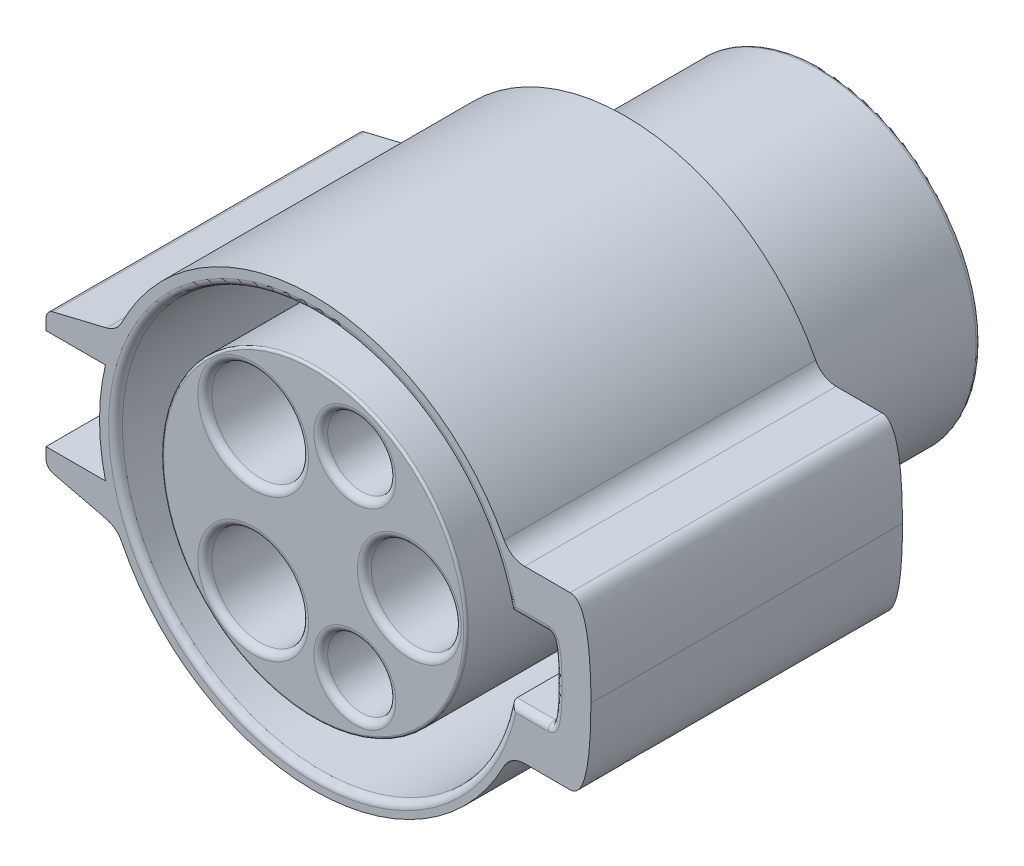
from build123d import *

# Parameters (mm, degrees)
BOSS_EXTRUDE2_DEPTH   = 31.75
SKETCH1_R             = 16.764
BOSS_EXTRUDE2_2_DEPTH = 31.75
BOSS_EXTRUDE3_START   = -2.54
SKETCH3_R             = 16.506246381
BOSS_EXTRUDE3_DEPTH   = 2.54
SKETCH4_R             = 17.526
BOSS_EXTRUDE4_DEPTH   = 24.13
SOCKETS_R             = 4.953
SOCKETS_R_2           = 3.7465
SOCKETS_R_3           = 5.334
CUT_EXTRUDE7_DEPTH    = 25.4
BOSS_EXTRUDE8_DEPTH   = 28.0924
CUT_EXTRUDE9_DEPTH    = 12.1158
CHAMFER4_SIZE         = 4.572
SCREWHOLES_R          = 1.27
CUT_EXTRUDE14_DEPTH   = 8.89
SKETCH11_R            = 5.6642
CUT_EXTRUDE15_DEPTH   = 22.86
SKETCH9_R             = 4.6482
CUT_EXTRUDE16_DEPTH   = 26.289
SKETCH10_R            = 5.6261
CUT_EXTRUDE17_DEPTH   = 26.7462
PIN_HOLES_R           = 0.762
PIN_HOLES_R_2         = 1.397
PIN_HOLES_R_3         = 1.8415
CUT_EXTRUDE18_DEPTH   = 57.15
FILLET2_R             = 2.54
FILLET1_R             = 0.762
FILLET3_R             = 0.762
FILLET4_R             = 0.762
FILLET5_R             = 2.54
FILLET7_R             = 0.254
FILLET8_R             = 0.508
FILLET9_R             = 0.508


with BuildPart() as part:
    # Sketch1 → Boss-Extrude2 (new body)
    with BuildSketch(Plane(origin=(0, 0, 0), x_dir=(-1, 0, 0), z_dir=(0, 0, 1))):
        with BuildLine():
            ThreePointArc((-21.65265327, -9.398341482), (-0.046598689, -23.566681465), (21.563577692, -9.40462903))
            Line((21.563577692, -9.40462903), (28.655385579, -7.694858892))
            ThreePointArc((28.655385579, -7.694858892), (29.198472422, -7.331979864), (29.408425429, -6.713478253))
            Line((29.408425429, -6.713478253), (29.408425429, -5.527673115))
            Line((29.408425429, -5.527673115), (22.863571754, -5.527673115))
            ThreePointArc((22.863571754, -5.527673115), (23.520338174, -0.003173115), (22.863571754, 5.521326885))
            Line((22.863571754, 5.521326885), (29.408425429, 5.521326885))
            Line((29.408425429, 5.521326885), (29.408425429, 6.701973171))
            ThreePointArc((29.408425429, 6.701973171), (29.198472422, 7.320474783), (28.655385579, 7.683353811))
            Line((28.655385579, 7.683353811), (21.563577692, 9.398282799))
            ThreePointArc((21.563577692, 9.398282799), (-0.043170424, 23.560335483), (-21.649918541, 9.398282799))
            Line((-21.649918541, 9.398282799), (-28.267762348, 9.398282799))
            add(Edge.make_bspline(
                [(-28.267762348, 9.398282799), (-28.485108011, 9.400451932), (-28.824047181, 9.276640589), (-29.19708151, 8.939349261), (-29.486145247, 8.48569004), (-29.78839701, 7.797643425), (-30.0551013, 6.826473269), (-30.270273152, 5.556194396), (-30.412261224, 4.212730774), (-30.527532893, 2.381439973), (-30.553793864, 0.956288487), (-30.55376699, 0)],
                knots=[0.008178357, 0.008178357, 0.008178357, 0.008178357, 0.0625, 0.125, 0.1875, 0.25, 0.375, 0.5, 0.625, 0.75, 0.99140647, 0.99140647, 0.99140647, 0.99140647], degree=3))
            add(Edge.make_bspline(
                [(-30.55376699, 0), (-30.553792628, -0.957105425), (-30.527486983, -2.383416883), (-30.411994616, -4.216077933), (-30.269722605, -5.560416862), (-30.054071551, -6.831375578), (-29.786697299, -7.802841402), (-29.483504172, -8.490718912), (-29.193429085, -8.943945804), (-28.820236065, -9.278541712), (-28.482332199, -9.400658469), (-28.267761491, -9.398341482)],
                knots=[0.008575453, 0.008575453, 0.008575453, 0.008575453, 0.25, 0.375, 0.5, 0.625, 0.75, 0.8125, 0.875, 0.9375, 0.991042124, 0.991042124, 0.991042124, 0.991042124], degree=3))
            Line((-28.267761491, -9.398341482), (-21.65265327, -9.398341482))
        make_face()
        with BuildLine():
            Line((-21.65265327, -4.280709616), (-25.856941927, -4.280709616))
            add(Edge.make_bspline(
                [(-26.618949643, 0), (-26.618952599, -0.409677807), (-26.61113914, -1.027795514), (-26.576415211, -1.835257877), (-26.532721349, -2.440331699), (-26.465680067, -3.022056645), (-26.380961079, -3.477974381), (-26.28265501, -3.812175786), (-26.18471138, -4.03861125), (-26.073308863, -4.197522787), (-25.951867174, -4.266036278), (-25.884930392, -4.280929674), (-25.856941927, -4.280709616)],
                knots=[0.013201178, 0.013201178, 0.013201178, 0.013201178, 0.25, 0.375, 0.5, 0.625, 0.75, 0.8125, 0.875, 0.9375, 0.96875, 0.984801607, 0.984801607, 0.984801607, 0.984801607], degree=3))
            add(Edge.make_bspline(
                [(-25.856941744, 4.280360411), (-25.891080394, 4.280844837), (-25.961281292, 4.263521273), (-26.081233259, 4.188207537), (-26.19056821, 4.028188874), (-26.286574032, 3.800969156), (-26.383475729, 3.466902404), (-26.467156775, 3.01187161), (-26.533512177, 2.431771639), (-26.576796215, 1.828599516), (-26.611211172, 1.023944975), (-26.618958231, 0.408107503), (-26.618949643, 0)],
                knots=[0.011727032, 0.011727032, 0.011727032, 0.011727032, 0.03125, 0.0625, 0.125, 0.1875, 0.25, 0.375, 0.5, 0.625, 0.75, 0.986731819, 0.986731819, 0.986731819, 0.986731819], degree=3))
            Line((-25.856941744, 4.280360411), (-21.680489311, 4.280360411))
            ThreePointArc((-21.680489311, 4.280360411), (21.759084844, 0.141022511), (-21.65265327, -4.280709616))
        make_face(mode=Mode.SUBTRACT)
    extrude(amount=BOSS_EXTRUDE2_DEPTH)



with BuildPart() as body_2:
    # Sketch1 → Boss-Extrude2 2 (new body)
    with BuildSketch(Plane(origin=(0, 0, 0), x_dir=(-1, 0, 0), z_dir=(0, 0, 1))):
        with Locations(Location((-0.043170424, -0.003173115, 0), (0, 0, 180))):
            Circle(SKETCH1_R)
    extrude(amount=BOSS_EXTRUDE2_2_DEPTH)


with BuildPart() as part_1:
    add(part.part)

    add(body_2.part)  # Boss-Extrude3 merges body 2
    # Sketch3 → Boss-Extrude3 (add)
    with BuildSketch(Plane.XY.offset(BOSS_EXTRUDE3_START)):
        with BuildLine():
            Line((-29.408425429, 5.527673115), (-22.863571754, 5.527673115))
            ThreePointArc((-22.863571754, 5.527673115), (-23.520338174, 0.003173115), (-22.863571754, -5.521326885))
            Line((-22.863571754, -5.521326885), (-29.408425429, -5.521326885))
            Line((-29.408425429, -5.521326885), (-29.408425429, -6.701973171))
            ThreePointArc((-29.408425429, -6.701973171), (-29.198472422, -7.320474783), (-28.655385579, -7.683353811))
            Line((-28.655385579, -7.683353811), (-21.563577692, -9.398282799))
            ThreePointArc((-21.563577692, -9.398282799), (0.043170424, -23.560335483), (21.649918541, -9.398282799))
            Line((21.649918541, -9.398282799), (28.267762348, -9.398282799))
            add(Edge.make_bspline(
                [(28.267762348, -9.398282799), (28.485108011, -9.400451932), (28.824047181, -9.276640589), (29.19708151, -8.939349261), (29.486145247, -8.48569004), (29.78839701, -7.797643425), (30.0551013, -6.826473269), (30.270273152, -5.556194396), (30.412261224, -4.212730774), (30.527532893, -2.381439973), (30.553793864, -0.956288487), (30.55376699, 0)],
                knots=[0.008178357, 0.008178357, 0.008178357, 0.008178357, 0.0625, 0.125, 0.1875, 0.25, 0.375, 0.5, 0.625, 0.75, 0.99140647, 0.99140647, 0.99140647, 0.99140647], degree=3, weights=[1, 1, 1, 1, 1, 1, 1, 1, 1, 1, 1, 1]))
            add(Edge.make_bspline(
                [(30.55376699, 0), (30.553792628, 0.957105425), (30.527486983, 2.383416883), (30.411994616, 4.216077933), (30.269722605, 5.560416862), (30.054071551, 6.831375578), (29.786697299, 7.802841402), (29.483504172, 8.490718912), (29.193429085, 8.943945804), (28.820236065, 9.278541712), (28.482332199, 9.400658469), (28.267761491, 9.398341482)],
                knots=[0.008575453, 0.008575453, 0.008575453, 0.008575453, 0.25, 0.375, 0.5, 0.625, 0.75, 0.8125, 0.875, 0.9375, 0.991042124, 0.991042124, 0.991042124, 0.991042124], degree=3, weights=[1, 1, 1, 1, 1, 1, 1, 1, 1, 1, 1, 1]))
            Line((28.267761491, 9.398341482), (21.65265327, 9.398341482))
            ThreePointArc((21.65265327, 9.398341482), (0.046598689, 23.566681465), (-21.563577692, 9.40462903))
            Line((-21.563577692, 9.40462903), (-28.655385579, 7.694858892))
            ThreePointArc((-28.655385579, 7.694858892), (-29.198472422, 7.331979864), (-29.408425429, 6.713478253))
            Line((-29.408425429, 6.713478253), (-29.408425429, 5.527673115))
        make_face()
        with Locations((0.043170424, 0.003173115)):
            Circle(SKETCH3_R, mode=Mode.SUBTRACT)
    extrude(amount=BOSS_EXTRUDE3_DEPTH)

    # Sketch4 → Boss-Extrude4 (add)
    with BuildSketch(Plane.XY):
        with Locations((0.043170424, 0.003173115)):
            Circle(SKETCH4_R)
    extrude(amount=-BOSS_EXTRUDE4_DEPTH)

    # sockets → Cut-Extrude7 (cut)
    with BuildSketch(Plane.XY.offset(31.75)):
        with Locations((10.5791, 0)):
            Circle(SOCKETS_R)
        with Locations((4.572, -10.541)):
            Circle(SOCKETS_R_2)
        with Locations((-6.604, -7.8359)):
            Circle(SOCKETS_R_3)
        with Locations((-6.604, 7.8359)):
            Circle(SOCKETS_R_3)
        with Locations((4.572, 10.541)):
            Circle(SOCKETS_R_2)
    extrude(amount=-CUT_EXTRUDE7_DEPTH, mode=Mode.SUBTRACT)

    # Sketch12 → Boss-Extrude8 (add)
    with BuildSketch(Plane.XY):
        with BuildLine():
            Line((-22.841283841, 5.503705795), (-26.727483841, 5.5245))
            Line((-26.727483841, 5.5245), (-26.727483841, -5.5245))
            Line((-26.727483841, -5.5245), (-22.836263371, -5.5245))
            ThreePointArc((-22.836263371, -5.5245), (-23.494997565, -0.010695841), (-22.841283841, 5.503705795))
        make_face()
    extrude(amount=BOSS_EXTRUDE8_DEPTH)

    # Sketch13 → Cut-Extrude9 (cut)
    with BuildSketch(Plane.XY):
        with BuildLine():
            Line((-22.841283841, 5.503705795), (-26.727483841, 5.5245))
            Line((-26.727483841, 5.5245), (-26.727483841, -5.5245))
            Line((-26.727483841, -5.5245), (-22.836263371, -5.5245))
            ThreePointArc((-22.836263371, -5.5245), (-23.494997565, -0.010695841), (-22.841283841, 5.503705795))
        make_face()
    extrude(amount=CUT_EXTRUDE9_DEPTH, mode=Mode.SUBTRACT)

    # Chamfer4
    # the kernel refuses this chamfer: 4.572 mm, written as the material it takes off along each edge
    with BuildSketch(Plane(origin=(-26.727483841, 17.282234621, 28.0924), x_dir=(0.9996219169112968, 7.071241747894203e-15, 0.02749587661058653), z_dir=(0, -1, 0))) as chamfer4_piece_1_section:
        Polygon((CHAMFER4_SIZE * 0.999621916911, -CHAMFER4_SIZE * 0.0274958766106), (-CHAMFER4_SIZE * 0.0274958766106, -CHAMFER4_SIZE * 0.999621916911), (0, 0), align=None)
    chamfer4_piece_1 = extrude(amount=22.803561506, mode=Mode.PRIVATE)
    chamfer4_piece_1 = chamfer4_piece_1 - Plane(origin=(0.043170424, 0.003173115, 26.490425122), x_dir=(-0.9721278171506141, 0.23445150270787823, 0), z_dir=(0, 0, -1)) * Cylinder(23.563508599, 64, mode=Mode.PRIVATE)
    chamfer4_piece_1 = split(chamfer4_piece_1, bisect_by=Plane(origin=(-25.329899538, 5.517021832, 26.490425122), z_dir=(-0.005350704467691729, -0.9999856848783885, 0)), keep=Keep.TOP, mode=Mode.PRIVATE)
    add(chamfer4_piece_1, mode=Mode.SUBTRACT)

    # screwholes → Cut-Extrude14 (cut)
    with BuildSketch(Plane.XY.offset(-24.13)):
        with Locations((1.275169865, 0.003025689)):
            Circle(SCREWHOLES_R)
        with Locations((-15.311029826, 0.005007879)):
            Circle(SCREWHOLES_R)
    extrude(amount=CUT_EXTRUDE14_DEPTH, mode=Mode.SUBTRACT)

    # Sketch11 → Cut-Extrude15 (cut)
    with BuildSketch(Plane.XY.offset(-24.13)):
        with Locations((10.5791, 0)):
            Circle(SKETCH11_R)
    extrude(amount=CUT_EXTRUDE15_DEPTH, mode=Mode.SUBTRACT)

    # Sketch9 → Cut-Extrude16 (cut)
    with BuildSketch(Plane.XY.offset(-24.13)):
        with Locations((4.572, 10.541)):
            Circle(SKETCH9_R)
        with Locations((4.572, -10.541)):
            Circle(SKETCH9_R)
    extrude(amount=CUT_EXTRUDE16_DEPTH, mode=Mode.SUBTRACT)

    # Sketch10 → Cut-Extrude17 (cut)
    with BuildSketch(Plane.XY.offset(-24.13)):
        with Locations(Location((-6.604, 7.8359, 0), (0, 0, 180))):
            Circle(SKETCH10_R)
        with Locations(Location((-6.604, -7.8359, 0), (0, 0, 180))):
            Circle(SKETCH10_R)
    extrude(amount=CUT_EXTRUDE17_DEPTH, mode=Mode.SUBTRACT)

    # pin holes → Cut-Extrude18 (cut)
    with BuildSketch(Plane.XY.offset(-24.13)):
        with Locations((4.572, 10.541)):
            Circle(PIN_HOLES_R)
        with Locations((10.5791, 0)):
            Circle(PIN_HOLES_R_2)
        with Locations((4.572, -10.541)):
            Circle(PIN_HOLES_R)
        with Locations((-6.604, -7.8359)):
            Circle(PIN_HOLES_R_3)
        with Locations((-6.604, 7.8359)):
            Circle(PIN_HOLES_R_3)
    extrude(amount=CUT_EXTRUDE18_DEPTH, mode=Mode.SUBTRACT)

    # Fillet2
    fillet2_edges = [part_1.edges().sort_by_distance(p)[0] for p in [
        (-21.563577692, 9.40462903, 14.605),
        (-21.563577692, -9.398282799, 14.605),
        (21.649918541, -9.398282799, 14.605),
        (21.65265327, 9.398341482, 14.605),
    ]]
    fillet(fillet2_edges, radius=FILLET2_R)

    # Fillet1
    fillet1_edges = [part_1.edges().sort_by_distance(p)[0] for p in [
        (-26.727483841, 0.001586558, 12.1158),
    ]]
    fillet(fillet1_edges, radius=FILLET1_R)

    # Fillet3
    fillet3_edges = [part_1.edges().sort_by_distance(p)[0] for p in [
        (0.8255, 10.541, 31.75),
        (-11.938, 7.8359, 31.75),
        (-11.938, -7.8359, 31.75),
        (0.8255, -10.541, 31.75),
        (5.6261, 0, 31.75),
    ]]
    fillet(fillet3_edges, radius=FILLET3_R)

    # Fillet4
    fillet4_edges = [part_1.edges().sort_by_distance(p)[0] for p in [
        (23.754797598, 4.280709616, 31.75),
        (26.544847632, -2.252592669, 31.75),
        (26.54481989, 2.252438392, 31.75),
        (-21.759084844, -0.141022511, 31.75),
    ]]
    fillet(fillet4_edges, radius=FILLET4_R)

    # Fillet5
    fillet5_edges = [part_1.edges().sort_by_distance(p)[0] for p in [
        (-17.482829576, 0.003173115, -2.54),
    ]]
    fillet(fillet5_edges, radius=FILLET5_R)

    # Fillet7
    fillet7_edges = [part_1.edges().sort_by_distance(p)[0] for p in [
        (-16.720829576, 0.003173115, 31.75),
    ]]
    fillet(fillet7_edges, radius=FILLET7_R)

    # Fillet8
    fillet8_edges = [part_1.edges().sort_by_distance(p)[0] for p in [
        (4.9149, 0, -24.13),
        (-0.0762, 10.541, -24.13),
        (-0.0762, -10.541, -24.13),
        (-0.9779, 7.8359, -24.13),
        (-0.9779, -7.8359, -24.13),
    ]]
    fillet(fillet8_edges, radius=FILLET8_R)

    # Fillet9
    fillet9_edges = [part_1.edges().sort_by_distance(p)[0] for p in [
        (-17.482829576, 0.003173115, -24.13),
    ]]
    fillet(fillet9_edges, radius=FILLET9_R)


solid = part_1.part
